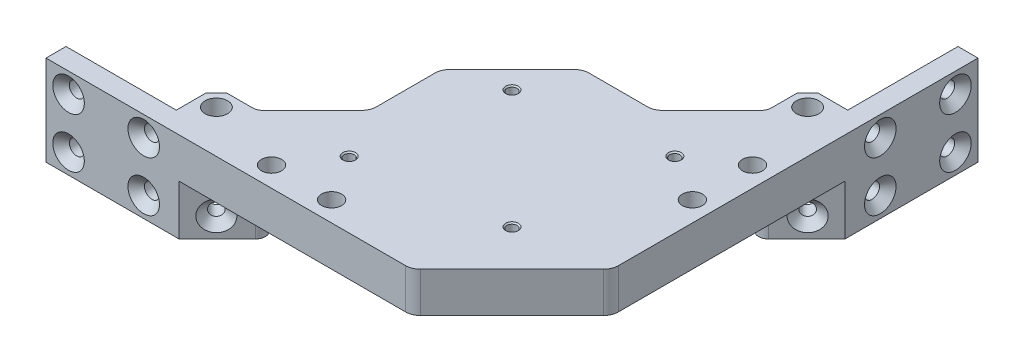
from build123d import *

# Parameters (mm, degrees)
SKETCH_1_R                     = 2.25
EXTRUDE_1_DEPTH                = 18
SKETCH_2_R                     = 1.5
CUT_EXTRUDE_1_DEPTH            = 130.976921028
CHAMFER_1_SIZE                 = 1.65
CHAMFER_2_SIZE                 = 2
CUT_EXTRUDE_2_DEPTH            = 10
HOLE_WIZARD_M3_1_D             = 2.5
HOLE_WIZARD_M3_1_CSINK_D       = 3.05
HOLE_WIZARD_M3_1_CSINK_ANGLE   = 90
CHAMFER_3_SIZE                 = 1.65
SKETCH_9_R                     = 2
CUT_EXTRUDE_3_DEPTH            = 133.747881353
CHAMFER_4_SIZE                 = 20
FILLET_1_R                     = 2
CUT_EXTRUDE_4_DEPTH            = 4
FILLET_2_R                     = 2
EXTRUDE_2_DEPTH                = 4
FILLET_3_R                     = 3
FILLET_4_R                     = 3
HOLE_WIZARD_M2_5_1_D           = 2.05
HOLE_WIZARD_M2_5_1_CSINK_D     = 2.55
HOLE_WIZARD_M2_5_1_CSINK_ANGLE = 90
SKETCH_15_W                    = 68.43860018
SKETCH_15_H                    = 10
CUT_EXTRUDE_5_DEPTH            = 87.446064633
FILLET_5_R                     = 2


with BuildPart() as part:
    # 草图1 → 凸台-拉伸1 (new body)
    with BuildSketch(Plane(origin=(0, 0, 0), x_dir=(1, 0, 0), z_dir=(0, 1, 0))):
        Polygon((0, 0), (0, 93), (-4, 93), (-4, 71), (-12, 71), (-12, 62.911688245), (-62.911688245, 12), (-71, 12), (-71, 4), (-93, 4), (-93, 0), align=None)
        with Locations(Location((-8.5, 67.5, 0), (0, 0, 270))):
            Circle(SKETCH_1_R, mode=Mode.SUBTRACT)
        with Locations(Location((-67.5, 8.5, 0), (0, 0, 90))):
            Circle(SKETCH_1_R, mode=Mode.SUBTRACT)
    extrude(amount=EXTRUDE_1_DEPTH)

    # 草图2 → 切除-拉伸1 (cut, through all)
    with BuildSketch(Plane(origin=(0, 0, -4), x_dir=(-1, 0, 0), z_dir=(0, 0, -1))):
        with Locations((73.5, 14)):
            Circle(SKETCH_2_R)
        with Locations((88.5, 14)):
            Circle(SKETCH_2_R)
        with Locations((88.5, 4)):
            Circle(SKETCH_2_R)
        with Locations((73.5, 4)):
            Circle(SKETCH_2_R)
    cut_extrude_1 = extrude(amount=-CUT_EXTRUDE_1_DEPTH, mode=Mode.SUBTRACT)

    # 镜向2: 切除-拉伸1 across plane
    add(cut_extrude_1.mirror(Plane(origin=(0, 0, 0), x_dir=(0.7071067811865513, 0, 0.7071067811865437), z_dir=(0.7071067811865437, 0, -0.7071067811865513))), mode=Mode.SUBTRACT)

    # 倒角1
    chamfer_1_edges = [part.edges().sort_by_distance(p)[0] for p in [
        (-72, 4, 0),
        (-87, 4, 0),
        (-87, 14, 0),
        (-72, 14, 0),
        (0, 4, -72),
        (0, 4, -87),
        (0, 14, -87),
        (0, 14, -72),
    ]]
    chamfer(chamfer_1_edges, length=CHAMFER_1_SIZE)

    # 倒角2
    chamfer_2_edges = [part.edges().sort_by_distance(p)[0] for p in [
        (-71, 9, -12),
        (-12, 9, -71),
    ]]
    chamfer(chamfer_2_edges, length=CHAMFER_2_SIZE)

    # 草图3 → 切除-拉伸2 (cut)
    with BuildSketch(Plane.XZ):
        Polygon((0, 0), (-66.426406871, 0), (0, -66.426406871), align=None)
    extrude(amount=-CUT_EXTRUDE_2_DEPTH, mode=Mode.SUBTRACT)

    # M3 螺纹孔1 (through all)
    with Locations(Plane(origin=(-40.5, 0, -40.5), x_dir=(-0.7071067811865498, 0, 0.7071067811865452), z_dir=(-0.7071067811865452, 0, -0.7071067811865498))):
        with Locations((-41.71930009, 4), (41.71930009, 4)):
            CounterSinkHole(HOLE_WIZARD_M3_1_D / 2, HOLE_WIZARD_M3_1_CSINK_D / 2, counter_sink_angle=HOLE_WIZARD_M3_1_CSINK_ANGLE)

    # 倒角3
    chamfer_3_edges = [part.edges().sort_by_distance(p)[0] for p in [
        (-63.597086912, 4, -2.829319959),
        (-4.597086912, 4, -61.829319959),
    ]]
    chamfer(chamfer_3_edges, length=CHAMFER_3_SIZE)

    # 草图9 → 切除-拉伸3 (cut, through all)
    with BuildSketch(Plane(origin=(0, 18, 0), x_dir=(1, 0, 0), z_dir=(0, 1, 0))):
        with Locations(Location((-52, 4, 0), (0, 0, 270))):
            Circle(SKETCH_9_R)
        with Locations(Location((-40, 4, 0), (0, 0, 270))):
            Circle(SKETCH_9_R)
        with Locations(Location((-4, 40, 0), (0, 0, 90))):
            Circle(SKETCH_9_R)
        with Locations(Location((-4, 52, 0), (0, 0, 90))):
            Circle(SKETCH_9_R)
    extrude(amount=-CUT_EXTRUDE_3_DEPTH, mode=Mode.SUBTRACT)

    # 倒角4
    chamfer_4_edges = [part.edges().sort_by_distance(p)[0] for p in [
        (0, 14, 0),
    ]]
    chamfer(chamfer_4_edges, length=CHAMFER_4_SIZE)

    # 圆角1
    fillet_1_edges = [part.edges().sort_by_distance(p)[0] for p in [
        (-62.911688245, 9, -12),
        (-12, 9, -62.911688245),
    ]]
    fillet(fillet_1_edges, radius=FILLET_1_R)

    # 草图10 → 切除-拉伸4 (cut)
    with BuildSketch(Plane.XZ.offset(-10)):
        Polygon((-58.926406871, -7.5), (-16.742640687, -7.5), (-7.5, -16.742640687), (-7.5, -58.926406871), align=None)
    extrude(amount=-CUT_EXTRUDE_4_DEPTH, mode=Mode.SUBTRACT)

    # 圆角2
    fillet_2_edges = [part.edges().sort_by_distance(p)[0] for p in [
        (-7.5, 12, -58.926406871),
        (-58.926406871, 12, -7.5),
        (-16.742640687, 12, -7.5),
        (-7.5, 12, -16.742640687),
    ]]
    fillet(fillet_2_edges, radius=FILLET_2_R)

    # 草图11 → 凸台-拉伸2 (add)
    with BuildSketch(Plane(origin=(0, 18, 0), x_dir=(1, 0, 0), z_dir=(0, 1, 0))):
        Polygon((-51.597979746, 23.313708499), (-51.597979746, 37.455844123), (-37.455844123, 51.597979746), (-23.313708499, 51.597979746), align=None)
    extrude(amount=-EXTRUDE_2_DEPTH)

    # 圆角3
    fillet_3_edges = [part.edges().sort_by_distance(p)[0] for p in [
        (-23.313708499, 16, -51.597979746),
        (-51.597979746, 16, -23.313708499),
        (-51.597979746, 16, -37.455844123),
        (-37.455844123, 16, -51.597979746),
    ]]
    fillet(fillet_3_edges, radius=FILLET_3_R)

    # 圆角4
    fillet_4_edges = [part.edges().sort_by_distance(p)[0] for p in [
        (0, 14, -20),
        (-20, 14, 0),
    ]]
    fillet(fillet_4_edges, radius=FILLET_4_R)

    # M2.5 螺纹孔1 (through all)
    with Locations(Plane(origin=(0, 18, 0), x_dir=(1, 0, 0), z_dir=(0, 1, 0))):
        with Locations((-45.771419869, 13.272792206), (-17.310371927, 17.310371927), (-40.991378029, 40.991378029), (-13.272792206, 45.771419869)):
            CounterSinkHole(HOLE_WIZARD_M2_5_1_D / 2, HOLE_WIZARD_M2_5_1_CSINK_D / 2, counter_sink_angle=HOLE_WIZARD_M2_5_1_CSINK_ANGLE)

    # 草图15 → 切除-拉伸5 (cut, through all)
    with BuildSketch(Plane(origin=(-33.213203436, 0, -33.213203436), x_dir=(0.7071067811865476, 0, -0.7071067811865475), z_dir=(0.7071067811865475, 0, 0.7071067811865476))):
        with Locations((0, 5)):
            Rectangle(SKETCH_15_W, SKETCH_15_H)
    extrude(amount=-CUT_EXTRUDE_5_DEPTH, mode=Mode.SUBTRACT)

    # 圆角5
    # the kernel refuses this fillet: 2 mm, written as the material it takes off along each edge
    with BuildSketch(Plane(origin=(-61.652543264, 10, -13.259144982), x_dir=(-0.7397286230240017, 0, 0.6729053159836194), z_dir=(0, -1, 0)), Plane(origin=(-13.259144982, -4.650863848, -61.652543264), x_dir=(0.6729053159836488, 0, -0.7397286230239748), z_dir=(0, 1, 0))) as fillet_5_piece_1:
        with BuildLine():
            CenterArc((1.909862491, -1.95277003), FILLET_5_R, 102.476415923, 74.815280531)
            Line((-0.087903584, -1.858267603), (-0.287680192, -1.848817361))
            Line((-0.287680192, -1.848817361), (-0.199776608, 0.009450243))
            Line((-0.199776608, 0.009450243), (0.009450243, 0.199776608))
            ThreePointArc((0.009450243, 0.199776608), (0.960659375, 0.154780563), (1.434579479, 0.195277003))
            Line((1.434579479, 0.195277003), (1.477787025, 0))
        make_face()
    extrude(amount=14.650863848, mode=Mode.SUBTRACT)
    with BuildSketch(Plane(origin=(-57.409902577, 10, -9.016504294), x_dir=(-0.7071067811865462, 0, -0.7071067811865489), z_dir=(0, -1, 0))) as fillet_5_piece_2:
        with BuildLine():
            CenterArc((FILLET_5_R, -FILLET_5_R), FILLET_5_R, 90, 90)
            Line((0, -FILLET_5_R), (0, 0))
            Line((0, 0), (FILLET_5_R, 0))
        make_face()
    extrude(amount=15, mode=Mode.SUBTRACT)
    with BuildSketch(Plane(origin=(-9.016504294, -5, -57.409902577), x_dir=(0.7071067811865487, 0, -0.7071067811865465), z_dir=(0, 1, 0))) as fillet_5_piece_3:
        with BuildLine():
            CenterArc((FILLET_5_R, FILLET_5_R), FILLET_5_R, 180, 90)
            Line((0, FILLET_5_R), (0, 0))
            Line((0, 0), (FILLET_5_R, 0))
        make_face()
    extrude(amount=15, mode=Mode.SUBTRACT)


solid = part.part
